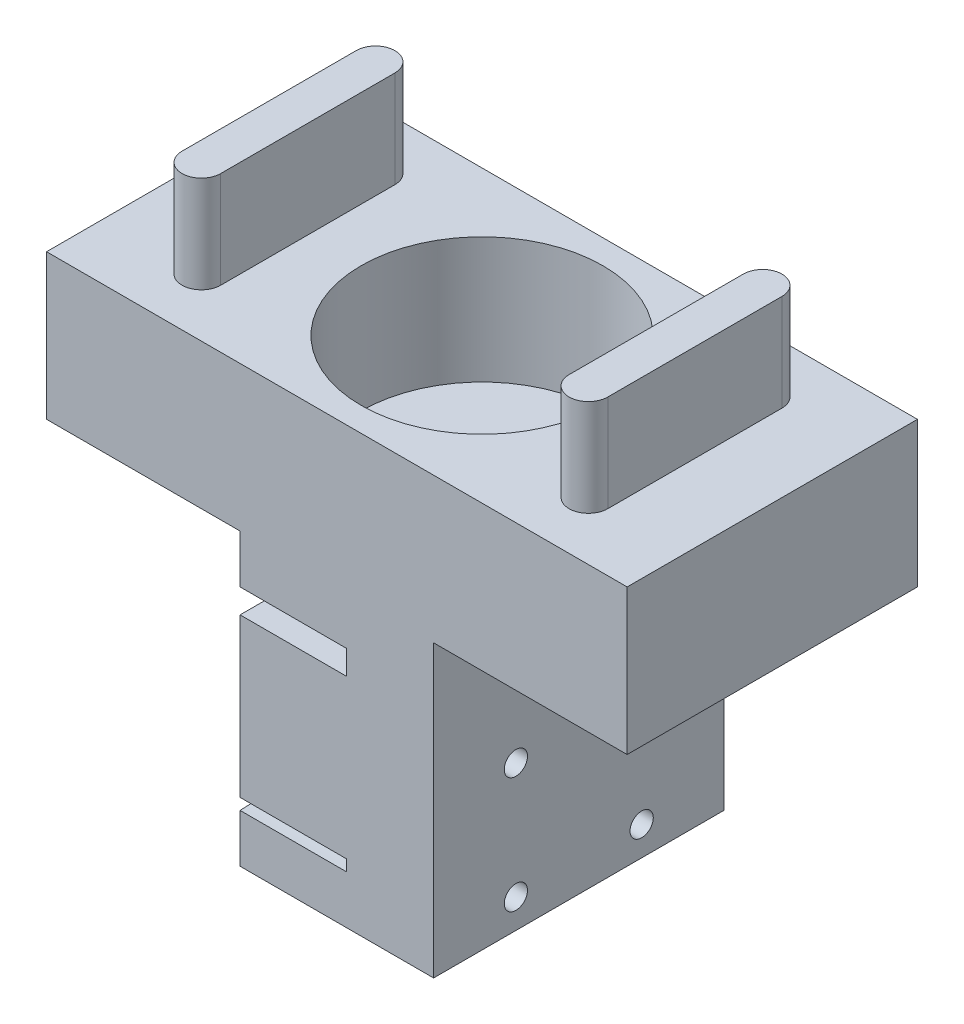
from build123d import *

# Parameters (mm, degrees)
SKETCH_1_W                   = 20
SKETCH_1_H                   = 30
EXTRUDE_1_DEPTH              = 30
CUT_EXTRUDE_1_DEPTH          = 11
SKETCH_5_W                   = 30
SKETCH_5_H                   = 2.5
CUT_EXTRUDE_2_DEPTH          = 11
HOLE_WIZARD_M2_1_D           = 2.4
HOLE_WIZARD_M2_1_CSINK_D     = 2.45
HOLE_WIZARD_M2_1_CSINK_ANGLE = 90
SKETCH_9_R                   = 2.5
CUT_EXTRUDE_3_DEPTH          = 10
SKETCH_10_W                  = 60
SKETCH_10_H                  = 30
EXTRUDE_2_DEPTH              = 15
SKETCH_11_R                  = 12.5
CUT_EXTRUDE_4_DEPTH          = 13
EXTRUDE_4_DEPTH              = 10


with BuildPart() as part:
    # 草图1 → 凸台-拉伸1 (new body)
    with BuildSketch(Plane.XY):
        with Locations((10, 15)):
            Rectangle(SKETCH_1_W, SKETCH_1_H)
    extrude(amount=EXTRUDE_1_DEPTH)

    # 草图3 → 切除-拉伸1 (cut)
    with BuildSketch(Plane.ZY):
        with BuildLine():
            Line((0.4, 6.166594535), (0.393686254, 6.416514795))
            ThreePointArc((0.393686254, 6.416514795), (0.955283537, 7.030449794), (1.59036417, 6.492880931))
            Line((1.59036417, 6.492880931), (1.615869647, 6.244185393))
            ThreePointArc((1.615869647, 6.244185393), (2.013267114, 6.2900196), (2.409380285, 6.345875455))
            Line((2.409380285, 6.345875455), (2.371349745, 6.59296588))
            ThreePointArc((2.371349745, 6.59296588), (2.850352659, 7.273306898), (3.548613469, 6.82082537))
            Line((3.548613469, 6.82082537), (3.605524384, 6.577389243))
            ThreePointArc((3.605524384, 6.577389243), (3.993872176, 6.673365873), (4.379672213, 6.779119607))
            Line((4.379672213, 6.779119607), (4.310541865, 7.019371548))
            ThreePointArc((4.310541865, 7.019371548), (4.699179349, 7.755081136), (5.449292168, 7.395027735))
            Line((5.449292168, 7.395027735), (5.536685232, 7.160800383))
            ThreePointArc((5.536685232, 7.160800383), (5.909683025, 7.305362366), (6.278910936, 7.459298295))
            Line((6.278910936, 7.459298295), (6.179802311, 7.688814046))
            ThreePointArc((6.179802311, 7.688814046), (6.471769341, 8.467956489), (7.261564783, 8.206172507))
            Line((7.261564783, 8.206172507), (7.378022182, 7.984953895))
            ThreePointArc((7.378022182, 7.984953895), (7.729618681, 8.175755946), (8.076284333, 8.375376702))
            Line((8.076284333, 8.375376702), (7.948805309, 8.590432738))
            ThreePointArc((7.948805309, 8.590432738), (8.139365186, 9.400367689), (8.956030077, 9.241100155))
            Line((8.956030077, 9.241100155), (9.099662477, 9.036479203))
            ThreePointArc((9.099662477, 9.036479203), (9.424153589, 9.270425861), (9.742632883, 9.512492918))
            Line((9.742632883, 9.512492918), (9.588851604, 9.709600295))
            ThreePointArc((9.588851604, 9.709600295), (9.674912797, 10.537187851), (10.505198052, 10.483020627))
            Line((10.505198052, 10.483020627), (10.673675244, 10.298316984))
            ThreePointArc((10.673675244, 10.298316984), (10.965796619, 10.571612837), (11.250922736, 10.852199041))
            Line((11.250922736, 10.852199041), (11.073334058, 11.028160007))
            ThreePointArc((11.073334058, 11.028160007), (11.053500362, 11.859973878), (11.883935924, 11.911785741))
            Line((11.883935924, 11.911785741), (12.074524636, 11.749995929))
            ThreePointArc((12.074524636, 11.749995929), (12.329537068, 12.058207188), (12.576684291, 12.372760475))
            Line((12.576684291, 12.372760475), (12.378169309, 12.524720344))
            ThreePointArc((12.378169309, 12.524720344), (12.252762493, 13.347265675), (13.069875869, 13.504216059))
            Line((13.069875869, 13.504216059), (13.279484101, 13.367964861))
            ThreePointArc((13.279484101, 13.367964861), (13.493250421, 13.706091289), (13.69840918, 14.049508533))
            Line((13.69840918, 14.049508533), (13.482188482, 14.175001997))
            ThreePointArc((13.482188482, 14.175001997), (13.253243072, 14.974934302), (14.043777899, 15.234476937))
            Line((14.043777899, 15.234476937), (14.043777899, 16.145250548))
            Line((14.043777899, 16.145250548), (15.956222101, 16.145250548))
            Line((15.956222101, 16.145250548), (15.956222101, 15.234476937))
            ThreePointArc((15.956222101, 15.234476937), (16.746756928, 14.974934302), (16.517811518, 14.175001997))
            Line((16.517811518, 14.175001997), (16.30159082, 14.049508533))
            ThreePointArc((16.30159082, 14.049508533), (16.506749579, 13.706091289), (16.720515899, 13.367964861))
            Line((16.720515899, 13.367964861), (16.930124131, 13.504216059))
            ThreePointArc((16.930124131, 13.504216059), (17.747237507, 13.347265675), (17.621830691, 12.524720344))
            Line((17.621830691, 12.524720344), (17.423315709, 12.372760475))
            ThreePointArc((17.423315709, 12.372760475), (17.670462932, 12.058207188), (17.925475364, 11.749995929))
            Line((17.925475364, 11.749995929), (18.116064076, 11.911785741))
            ThreePointArc((18.116064076, 11.911785741), (18.946499638, 11.859973878), (18.926665942, 11.028160007))
            Line((18.926665942, 11.028160007), (18.749077264, 10.852199041))
            ThreePointArc((18.749077264, 10.852199041), (19.034203381, 10.571612837), (19.326324756, 10.298316984))
            Line((19.326324756, 10.298316984), (19.494801948, 10.483020627))
            ThreePointArc((19.494801948, 10.483020627), (20.325087203, 10.537187851), (20.411148396, 9.709600295))
            Line((20.411148396, 9.709600295), (20.257367117, 9.512492918))
            ThreePointArc((20.257367117, 9.512492918), (20.575846411, 9.270425861), (20.900337523, 9.036479203))
            Line((20.900337523, 9.036479203), (21.043969923, 9.241100155))
            ThreePointArc((21.043969923, 9.241100155), (21.860634814, 9.400367689), (22.051194691, 8.590432738))
            Line((22.051194691, 8.590432738), (21.923715667, 8.375376702))
            ThreePointArc((21.923715667, 8.375376702), (22.270381319, 8.175755946), (22.621977818, 7.984953895))
            Line((22.621977818, 7.984953895), (22.738435217, 8.206172507))
            ThreePointArc((22.738435217, 8.206172507), (23.528230659, 8.467956489), (23.820197689, 7.688814046))
            Line((23.820197689, 7.688814046), (23.721089064, 7.459298295))
            ThreePointArc((23.721089064, 7.459298295), (24.090316975, 7.305362366), (24.463314768, 7.160800383))
            Line((24.463314768, 7.160800383), (24.550707832, 7.395027735))
            ThreePointArc((24.550707832, 7.395027735), (25.300820651, 7.755081136), (25.689458135, 7.019371548))
            Line((25.689458135, 7.019371548), (25.620327787, 6.779119607))
            ThreePointArc((25.620327787, 6.779119607), (26.006127824, 6.673365873), (26.394475616, 6.577389243))
            Line((26.394475616, 6.577389243), (26.451386531, 6.82082537))
            ThreePointArc((26.451386531, 6.82082537), (27.149647341, 7.273306898), (27.628650255, 6.59296588))
            Line((27.628650255, 6.59296588), (27.590619715, 6.345875455))
            ThreePointArc((27.590619715, 6.345875455), (27.986732886, 6.2900196), (28.384130353, 6.244185393))
            Line((28.384130353, 6.244185393), (28.40963583, 6.492880931))
            ThreePointArc((28.40963583, 6.492880931), (29.044716463, 7.030449794), (29.606313746, 6.416514795))
            Line((29.606313746, 6.416514795), (29.6, 6.166594535))
            ThreePointArc((29.6, 6.166594535), (29.79998405, 6.162805733), (30, 6.161542732))
            Line((30, 6.161542732), (30, 5))
            ThreePointArc((30, 5), (21.253572158, 7.422620263), (15, 14))
            ThreePointArc((15, 14), (8.746427842, 7.422620263), (0, 5))
            Line((0, 5), (0, 6.161542732))
            ThreePointArc((0, 6.161542732), (0.20001595, 6.162805733), (0.4, 6.166594535))
        make_face()
    extrude(amount=-CUT_EXTRUDE_1_DEPTH, mode=Mode.SUBTRACT)

    # 草图5 → 切除-拉伸2 (cut)
    with BuildSketch(Plane.ZY):
        Polygon((12, 21), (12, 11.034671027), (15, 15.309401077), (18, 11.034671027), (18, 21), align=None)
        with Locations((15, 23.75)):
            Rectangle(SKETCH_5_W, SKETCH_5_H)
    extrude(amount=-CUT_EXTRUDE_2_DEPTH, mode=Mode.SUBTRACT)

    # M2 间隙孔1 (through all)
    with Locations(Plane.ZY):
        with Locations((21.5, 15), (8.5, 3), (8.5, 15), (21.5, 3)):
            CounterSinkHole(HOLE_WIZARD_M2_1_D / 2, HOLE_WIZARD_M2_1_CSINK_D / 2, counter_sink_angle=HOLE_WIZARD_M2_1_CSINK_ANGLE)

    # 草图9 → 切除-拉伸3 (cut)
    with BuildSketch(Plane.ZY):
        with Locations((8.5, 15)):
            Circle(SKETCH_9_R)
        with Locations((8.5, 3)):
            Circle(SKETCH_9_R)
        with Locations((21.5, 15)):
            Circle(SKETCH_9_R)
        with Locations((21.5, 3)):
            Circle(SKETCH_9_R)
    extrude(amount=-CUT_EXTRUDE_3_DEPTH, mode=Mode.SUBTRACT)

    # 草图10 → 凸台-拉伸2 (add)
    with BuildSketch(Plane(origin=(0, 30, 0), x_dir=(1, 0, 0), z_dir=(0, 1, 0))):
        with Locations((10, -15)):
            Rectangle(SKETCH_10_W, SKETCH_10_H)
    extrude(amount=EXTRUDE_2_DEPTH)

    # 草图11 → 切除-拉伸4 (cut)
    with BuildSketch(Plane(origin=(0, 45, 0), x_dir=(1, 0, 0), z_dir=(0, 1, 0))):
        with Locations((10, -15)):
            Circle(SKETCH_11_R)
    extrude(amount=-CUT_EXTRUDE_4_DEPTH, mode=Mode.SUBTRACT)

    # 草图12 → 凸台-拉伸4 (add)
    with BuildSketch(Plane(origin=(0, 45, 0), x_dir=(1, 0, 0), z_dir=(0, 1, 0))):
        with BuildLine():
            Line((-12, -6), (-12, -24))
            ThreePointArc((-12, -24), (-10, -26), (-8, -24))
            Line((-8, -24), (-8, -6))
            ThreePointArc((-8, -6), (-10, -4), (-12, -6))
        make_face()
        with BuildLine():
            Line((28, -6), (28, -24))
            ThreePointArc((28, -24), (30, -26), (32, -24))
            Line((32, -24), (32, -6))
            ThreePointArc((32, -6), (30, -4), (28, -6))
        make_face()
    extrude(amount=EXTRUDE_4_DEPTH)


solid = part.part
